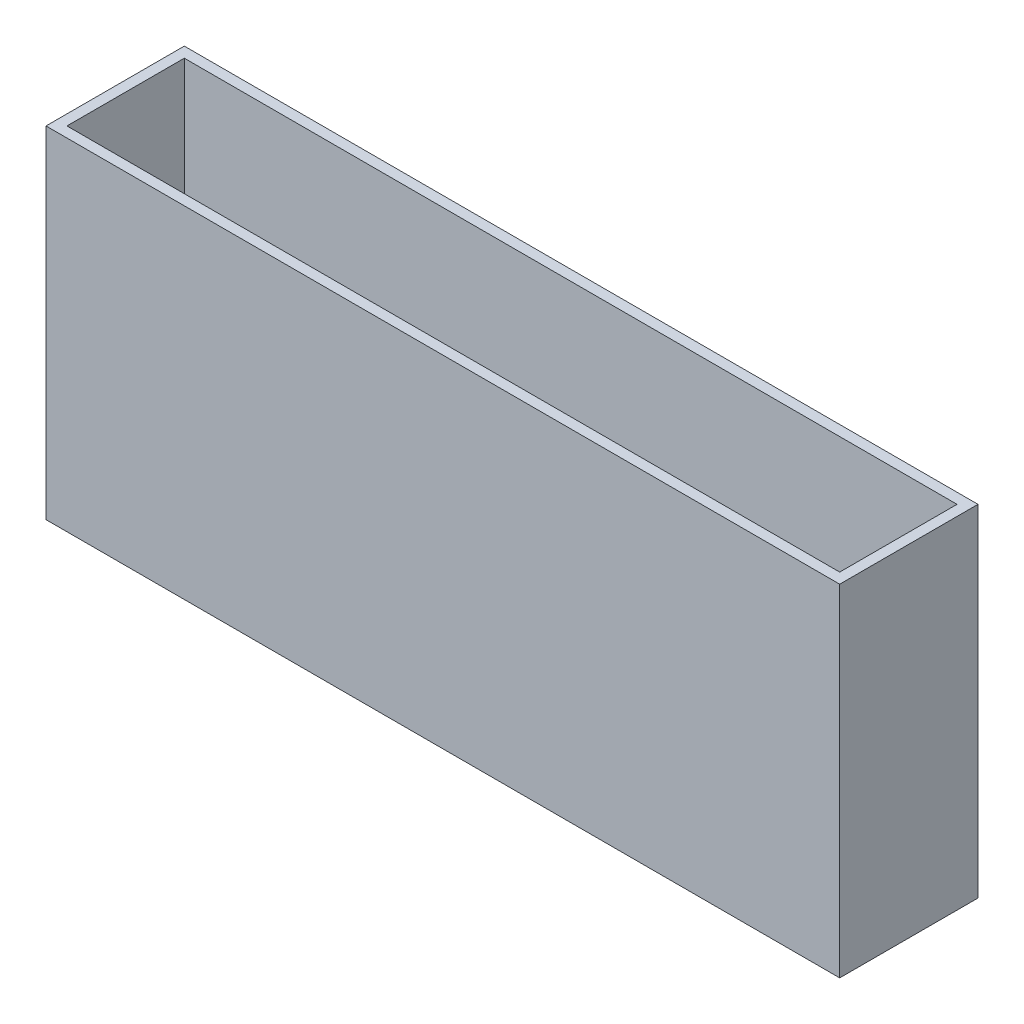
from build123d import *

# Parameters (mm, degrees)
SKETCH1_W           = 303
SKETCH1_H           = 52.8
BOSS_EXTRUDE1_DEPTH = 3.175
SKETCH2_W           = 303
SKETCH2_H           = 52.8
SKETCH2_W_2         = 295
SKETCH2_H_2         = 44.8
BOSS_EXTRUDE2_DEPTH = 127


with BuildPart() as part:
    # Sketch1 → Boss-Extrude1 (new body)
    with BuildSketch(Plane(origin=(0, 0, 0), x_dir=(1, 0, 0), z_dir=(0, 1, 0))):
        Rectangle(SKETCH1_W, SKETCH1_H)
    extrude(amount=BOSS_EXTRUDE1_DEPTH)

    # Sketch2 → Boss-Extrude2 (add)
    with BuildSketch(Plane(origin=(0, 3.175, 0), x_dir=(1, 0, 0), z_dir=(0, 1, 0))):
        Rectangle(SKETCH2_W, SKETCH2_H)
        Rectangle(SKETCH2_W_2, SKETCH2_H_2, mode=Mode.SUBTRACT)
    extrude(amount=BOSS_EXTRUDE2_DEPTH)


solid = part.part
